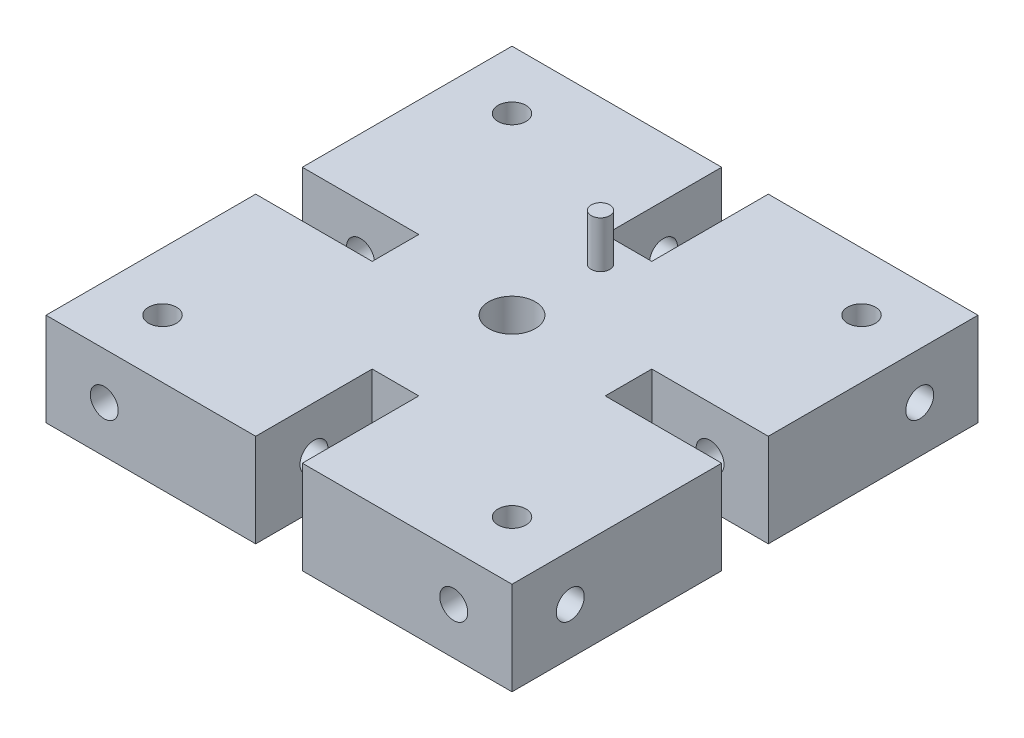
from build123d import *

# Parameters (mm, degrees)
BOSS_EXTRUDE1_DEPTH = 10
SKETCH3_R           = 1.5
CUT_EXTRUDE1_DEPTH  = 39.487010796
SKETCH4_R           = 1.5
CUT_EXTRUDE2_DEPTH  = 39.487010796
SKETCH5_R           = 2.5
CUT_EXTRUDE3_DEPTH  = 10
SKETCH6_R           = 1
BOSS_EXTRUDE2_DEPTH = 5
SKETCH9_R           = 1.5
CUT_EXTRUDE4_DEPTH  = 37.742346142


with BuildPart() as part:
    # Sketch1 → Boss-Extrude1 (new body)
    with BuildSketch(Plane(origin=(0, 0, 0), x_dir=(1, 0, 0), z_dir=(0, 1, 0))):
        Polygon((-25, 25), (-25, 2.5), (-12.5, 2.5), (-12.5, -2.5), (-25, -2.5), (-25, -25), (-2.5, -25), (-2.5, -12.5), (2.5, -12.5), (2.5, -25), (25, -25), (25, -2.5), (12.5, -2.5), (12.5, 2.5), (25, 2.5), (25, 25), (2.5, 25), (2.5, 12.5), (-2.5, 12.5), (-2.5, 25), align=None)
    extrude(amount=BOSS_EXTRUDE1_DEPTH)

    # Sketch3 → Cut-Extrude1 (cut, symmetric)
    with BuildSketch(Plane.ZY.offset(2.5)):
        with Locations((-18.75, 5)):
            Circle(SKETCH3_R)
    cut_extrude1 = extrude(amount=CUT_EXTRUDE1_DEPTH, both=True, mode=Mode.SUBTRACT)

    # Mirror1: Cut-Extrude1 across plane
    add(cut_extrude1.mirror(Plane.XY), mode=Mode.SUBTRACT)

    # Sketch4 → Cut-Extrude2 (cut, symmetric)
    with BuildSketch(Plane.XY.offset(2.5)):
        with Locations((-18.75, 5)):
            Circle(SKETCH4_R)
    cut_extrude2 = extrude(amount=CUT_EXTRUDE2_DEPTH, both=True, mode=Mode.SUBTRACT)

    # Mirror2: Cut-Extrude2 across plane
    add(cut_extrude2.mirror(Plane(origin=(0, 0, 0), x_dir=(0, 0, 1), z_dir=(1, 0, 0))), mode=Mode.SUBTRACT)

    # Sketch5 → Cut-Extrude3 (cut)
    with BuildSketch(Plane(origin=(0, 10, 0), x_dir=(1, 0, 0), z_dir=(0, 1, 0))):
        Circle(SKETCH5_R)
    extrude(amount=-CUT_EXTRUDE3_DEPTH, mode=Mode.SUBTRACT)

    # Sketch6 → Boss-Extrude2 (add)
    with BuildSketch(Plane(origin=(0, 10, 0), x_dir=(1, 0, 0), z_dir=(0, 1, 0))):
        with Locations((0, 9.5)):
            Circle(SKETCH6_R)
    extrude(amount=BOSS_EXTRUDE2_DEPTH)

    # Sketch9 → Cut-Extrude4 (cut, through all)
    with BuildSketch(Plane(origin=(0, 10, 0), x_dir=(1, 0, 0), z_dir=(0, 1, 0))):
        with Locations((-18.75, 18.75)):
            Circle(SKETCH9_R)
        with Locations((18.75, 18.75)):
            Circle(SKETCH9_R)
        with Locations((18.75, -18.75)):
            Circle(SKETCH9_R)
        with Locations((-18.75, -18.75)):
            Circle(SKETCH9_R)
    extrude(amount=-CUT_EXTRUDE4_DEPTH, mode=Mode.SUBTRACT)


solid = part.part
